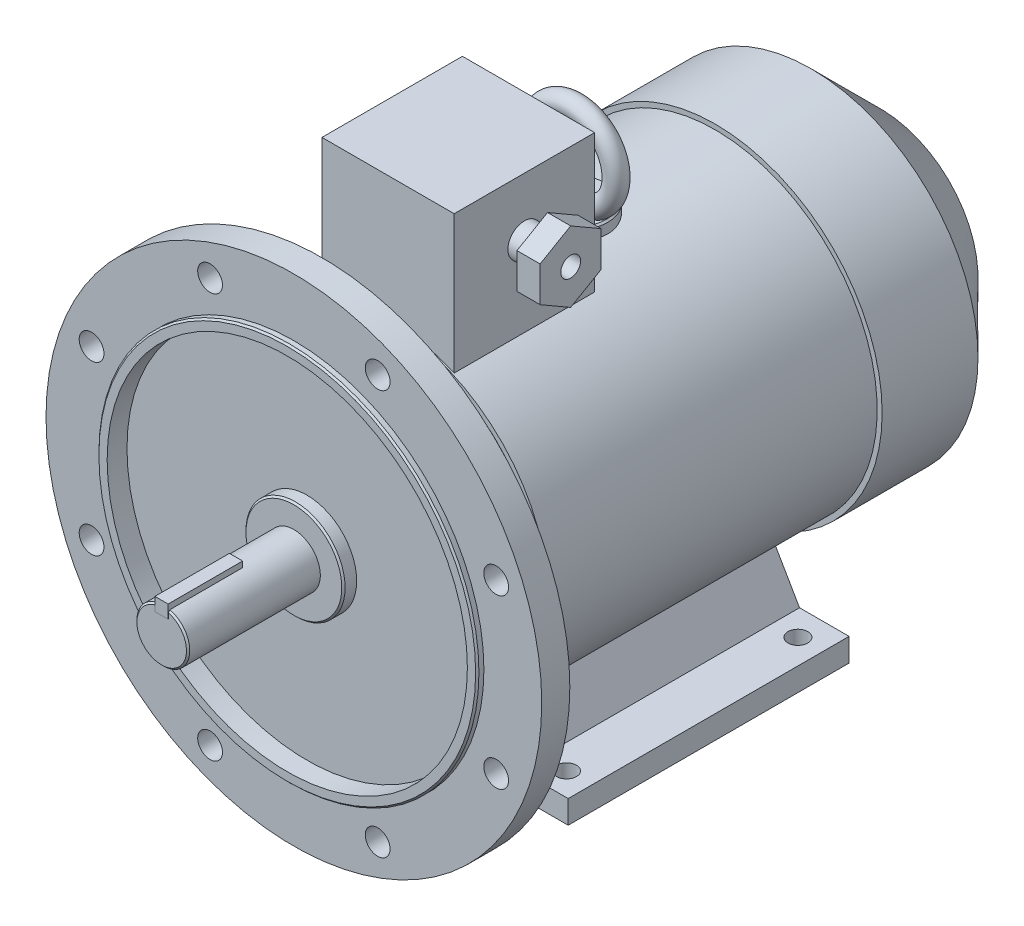
from build123d import *

# Parameters (mm, degrees)
SKETCH_1_R           = 16
EXTRUDE_1_DEPTH      = 80
SKETCH_2_R           = 150
EXTRUDE_2_DEPTH      = 17
EXTRUDE_3_DEPTH      = 0.1
EXTRUDE_3_DEPTH_BACK = 45
SKETCH_3_W           = 8
SKETCH_3_H           = 8
SKETCH_4_R           = 115
SKETCH_4_R_2         = 109
EXTRUDE_4_DEPTH      = 4
CUT_EXTRUDE_START    = -8
SKETCH_5_R           = 109
SKETCH_5_R_2         = 30
CUT_EXTRUDE_1_DEPTH  = 8
CHAMFER_1_SIZE       = 1
SKETCH_6_R           = 7.5
CUT_EXTRUDE_2_DEPTH  = 227.750986767
SKETCH_7_R           = 95
EXTRUDE_5_DEPTH      = 39
SKETCH_8_R           = 98
EXTRUDE_6_DEPTH      = 199
SKETCH_9_R           = 101
EXTRUDE_7_DEPTH      = 100
CHAMFER_2_SIZE       = 42
EXTRUDE_8_DEPTH      = 170
CUT_EXTRUDE_3_REACH  = 468.014
SKETCH_11_R          = 6
SKETCH_12_W          = 80
SKETCH_12_H          = 85
EXTRUDE_9_DEPTH      = 173
SKETCH_13_R          = 20
EXTRUDE_10_DEPTH     = 103
CHAMFER_3_SIZE       = 1
SKETCH_15_R          = 6
SKETCH_16_R          = 10
EXTRUDE_11_DEPTH     = 14
EXTRUDE_12_DEPTH     = 14
SKETCH_18_R          = 6
CUT_EXTRUDE_4_DEPTH  = 14


with BuildPart() as part:
    # Эскиз1 → Вытянуть1 (new body)
    with BuildSketch(Plane.XY):
        Circle(SKETCH_1_R)
    extrude(amount=EXTRUDE_1_DEPTH)

    # Эскиз2 → Вытянуть2 (add)
    with BuildSketch(Plane(origin=(0, 0, 0), x_dir=(-1, 0, 0), z_dir=(0, 0, -1))):
        Circle(SKETCH_2_R)
    extrude(amount=EXTRUDE_2_DEPTH)

    # Эскиз3 → Вытянуть3 (add, two sides: drawn at the far end of the back side and taken through both)
    with BuildSketch(Plane.XY.offset(80).offset(-EXTRUDE_3_DEPTH_BACK)):
        with Locations((0, 15)):
            Rectangle(SKETCH_3_W, SKETCH_3_H)
    extrude(amount=EXTRUDE_3_DEPTH + EXTRUDE_3_DEPTH_BACK)

    # Эскиз4 → Вытянуть4 (add)
    with BuildSketch(Plane.XY):
        Circle(SKETCH_4_R)
        Circle(SKETCH_4_R_2, mode=Mode.SUBTRACT)
    extrude(amount=EXTRUDE_4_DEPTH)

    # Эскиз5 → Вырез-Вытянуть1 (cut)
    with BuildSketch(Plane.XY.offset(CUT_EXTRUDE_START)):
        Circle(SKETCH_5_R)
        Circle(SKETCH_5_R_2, mode=Mode.SUBTRACT)
    extrude(amount=CUT_EXTRUDE_1_DEPTH, mode=Mode.SUBTRACT)

    # Фаска1
    chamfer_1_edges = [part.edges().sort_by_distance(p)[0] for p in [
        (-9.797958971, -12.649110641, 80),
        (-30, 0, 0),
        (-115, 0, 4),
    ]]
    chamfer(chamfer_1_edges, length=CHAMFER_1_SIZE)

    # Эскиз6 → Вырез-Вытянуть2 (cut, through all)
    with BuildSketch(Plane.XY):
        with Locations((-50.705554788, 122.414038058)):
            Circle(SKETCH_6_R)
        with Locations((50.705554788, 122.414038058)):
            Circle(SKETCH_6_R)
        with Locations((122.414038058, 50.705554788)):
            Circle(SKETCH_6_R)
        with Locations((122.414038058, -50.705554788)):
            Circle(SKETCH_6_R)
        with Locations((50.705554788, -122.414038058)):
            Circle(SKETCH_6_R)
        with Locations((-50.705554788, -122.414038058)):
            Circle(SKETCH_6_R)
        with Locations((-122.414038058, -50.705554788)):
            Circle(SKETCH_6_R)
        with Locations((-122.414038058, 50.705554788)):
            Circle(SKETCH_6_R)
    extrude(amount=-CUT_EXTRUDE_2_DEPTH, mode=Mode.SUBTRACT)

    # Эскиз7 → Вытянуть5 (add)
    with BuildSketch(Plane(origin=(0, 0, -17), x_dir=(-1, 0, 0), z_dir=(0, 0, -1))):
        Circle(SKETCH_7_R)
    extrude(amount=EXTRUDE_5_DEPTH)

    # Эскиз8 → Вытянуть6 (add)
    with BuildSketch(Plane(origin=(0, 0, -56), x_dir=(-1, 0, 0), z_dir=(0, 0, -1))):
        Circle(SKETCH_8_R)
    extrude(amount=EXTRUDE_6_DEPTH)

    # Эскиз9 → Вытянуть7 (add)
    with BuildSketch(Plane(origin=(0, 0, -255), x_dir=(-1, 0, 0), z_dir=(0, 0, -1))):
        Circle(SKETCH_9_R)
    extrude(amount=EXTRUDE_7_DEPTH)

    # Фаска2
    chamfer_2_edges = [part.edges().sort_by_distance(p)[0] for p in [
        (101, 0, -355),
    ]]
    chamfer(chamfer_2_edges, length=CHAMFER_2_SIZE)

    # Эскиз10 → Вытянуть8 (add)
    with BuildSketch(Plane.XY.offset(-56)):
        Polygon((-110, -112), (-71.917096231, -112), (-51.440399562, -76.533320997), (-63.564755215, -69.533320997), (-80, -98), (-110, -98), align=None)
        Polygon((110, -98), (110, -112), (71.917096231, -112), (51.440399562, -76.533320997), (63.564755215, -69.533320997), (80, -98), align=None)
    extrude(amount=-EXTRUDE_8_DEPTH)

    # Эскиз11 → Вырез-Вытянуть3 (cut, up to next)
    with BuildSketch(Plane.XZ.offset(112), mode=Mode.PRIVATE) as cut_extrude_3_sk1:
        with Locations((95, -70)):
            Circle(SKETCH_11_R)
    cut_extrude_3_tool1 = extrude(cut_extrude_3_sk1.sketch, amount=-CUT_EXTRUDE_3_REACH, mode=Mode.PRIVATE) & part.part
    # Эскиз11 → Вырез-Вытянуть3 (cut, up to next)
    with BuildSketch(Plane.XZ.offset(112), mode=Mode.PRIVATE) as cut_extrude_3_sk2:
        with Locations((-95, -70)):
            Circle(SKETCH_11_R)
    cut_extrude_3_tool2 = extrude(cut_extrude_3_sk2.sketch, amount=-CUT_EXTRUDE_3_REACH, mode=Mode.PRIVATE) & part.part
    # Эскиз11 → Вырез-Вытянуть3 (cut, up to next)
    with BuildSketch(Plane.XZ.offset(112), mode=Mode.PRIVATE) as cut_extrude_3_sk3:
        with Locations((95, -210)):
            Circle(SKETCH_11_R)
    cut_extrude_3_tool3 = extrude(cut_extrude_3_sk3.sketch, amount=-CUT_EXTRUDE_3_REACH, mode=Mode.PRIVATE) & part.part
    # Эскиз11 → Вырез-Вытянуть3 (cut, up to next)
    with BuildSketch(Plane.XZ.offset(112), mode=Mode.PRIVATE) as cut_extrude_3_sk4:
        with Locations((-95, -210)):
            Circle(SKETCH_11_R)
    cut_extrude_3_tool4 = extrude(cut_extrude_3_sk4.sketch, amount=-CUT_EXTRUDE_3_REACH, mode=Mode.PRIVATE) & part.part
    add(cut_extrude_3_tool1.solids().sort_by_distance((95, -112, -70))[0], mode=Mode.SUBTRACT)
    add(cut_extrude_3_tool2.solids().sort_by_distance((-95, -112, -70))[0], mode=Mode.SUBTRACT)
    add(cut_extrude_3_tool3.solids().sort_by_distance((95, -112, -210))[0], mode=Mode.SUBTRACT)
    add(cut_extrude_3_tool4.solids().sort_by_distance((-95, -112, -210))[0], mode=Mode.SUBTRACT)

    # Эскиз12 → Вытянуть9 (add)
    with BuildSketch(Plane(origin=(0, 0, 0), x_dir=(1, 0, 0), z_dir=(0, 1, 0))):
        with Locations((0, 99.5)):
            Rectangle(SKETCH_12_W, SKETCH_12_H)
    extrude(amount=EXTRUDE_9_DEPTH)

    # Эскиз13 → Вытянуть10 (add)
    with BuildSketch(Plane(origin=(0, 0, 0), x_dir=(1, 0, 0), z_dir=(0, 1, 0))):
        with Locations((0, 170)):
            Circle(SKETCH_13_R)
    extrude(amount=EXTRUDE_10_DEPTH)

    # Фаска3
    chamfer_3_edges = [part.edges().sort_by_distance(p)[0] for p in [
        (-20, 103, -170),
    ]]
    chamfer(chamfer_3_edges, length=CHAMFER_3_SIZE)

    # По траектории1: sweep along a path in Эскиз14
    with BuildLine(Plane.XY.offset(-170)) as sweep_1_path:
        CenterArc((0, 128), 25, 0, 360)
    # Эскиз15 → По траектории1 (sweep)
    with BuildSketch(Plane(origin=(0, 0, 0), x_dir=(0, 0, -1), z_dir=(1, 0, 0))):
        with Locations((170, 153)):
            Circle(SKETCH_15_R)
    sweep(path=sweep_1_path.line)

    # Эскиз16 → Вытянуть11 (add)
    with BuildSketch(Plane(origin=(40, 0, 0), x_dir=(0, 0, -1), z_dir=(1, 0, 0))):
        with Locations((99.5, 138)):
            Circle(SKETCH_16_R)
    extrude(amount=EXTRUDE_11_DEPTH)

    # Эскиз17 → Вытянуть12 (add)
    with BuildSketch(Plane(origin=(54, 0, 0), x_dir=(0, 0, -1), z_dir=(1, 0, 0))):
        Polygon((99.5, 159.36195996), (81, 148.68097998), (81, 127.31902002), (99.5, 116.63804004), (118, 127.31902002), (118, 148.68097998), align=None)
    extrude(amount=EXTRUDE_12_DEPTH)

    # Эскиз18 → Вырез-Вытянуть4 (cut)
    with BuildSketch(Plane(origin=(68, 0, 0), x_dir=(0, 0, -1), z_dir=(1, 0, 0))):
        with Locations((99.5, 138)):
            Circle(SKETCH_18_R)
    extrude(amount=-CUT_EXTRUDE_4_DEPTH, mode=Mode.SUBTRACT)


solid = part.part
